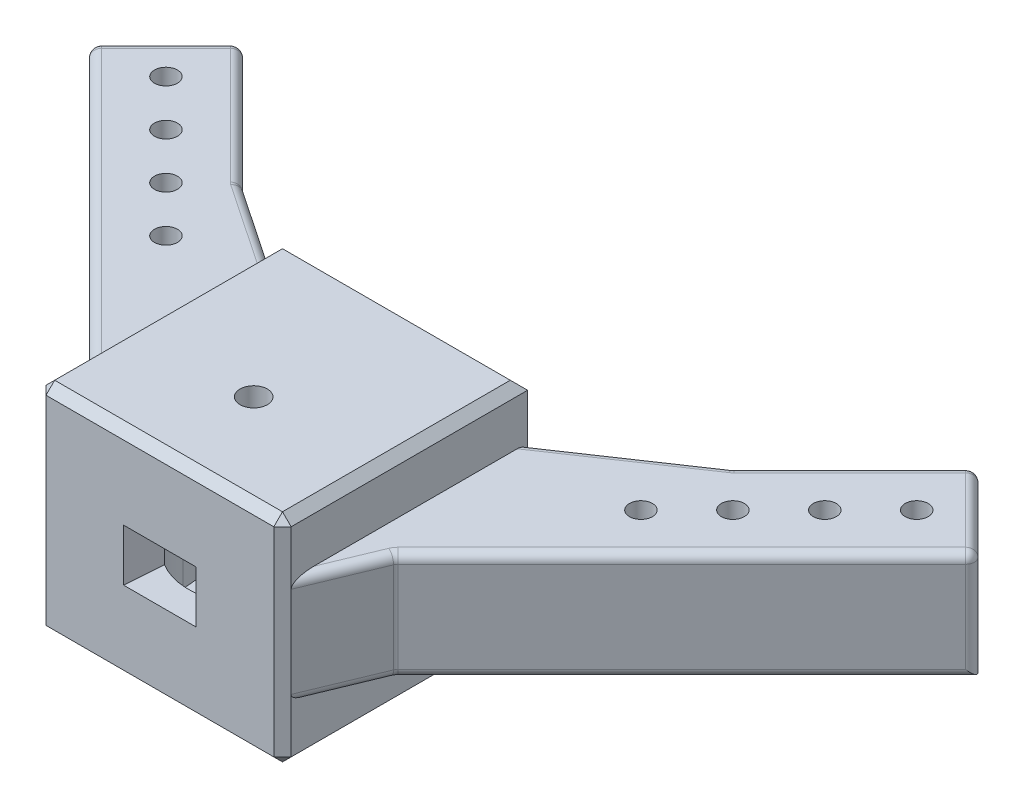
from build123d import *

# Parameters (mm, degrees)
SKETCH_1_W                      = 56.568542494
SKETCH_1_H                      = 56.568542494
SKETCH_1_R                      = 3.15
EXTRUDE_1_DEPTH                 = 25
SKETCH_1_3_R                    = 15
SKETCH_1_3_R_2                  = 3.15
CUT_EXTRUDE_1_DEPTH             = 20.15
EXTRUDE_2_DEPTH                 = 12.5
HOLE_WIZARD_15_25_15_25_1_D     = 15.3
HOLE_WIZARD_15_25_15_25_1_DEPTH = 75
SKETCH_8_R                      = 2.65
CUT_EXTRUDE_2_DEPTH             = 25
CUT_EXTRUDE_3_DEPTH             = 6
FILLET_3_R                      = 2
FILLET_4_R                      = 2
FILLET_5_R                      = 2
CHAMFER_3_SIZE                  = 1
CHAMFER_4_SIZE                  = 2


# Some blends are built 0.0001 mm under size
with BuildPart() as part:
    # 草图1 → 凸台-拉伸1 (new, symmetric)
    with BuildSketch(Plane(origin=(0, 0, 0), x_dir=(1, 0, 0), z_dir=(0, 1, 0))):
        Rectangle(SKETCH_1_W, SKETCH_1_H)
        with Locations(Location((0, -6.646698667, 0), (0, 0, 270))):
            Circle(SKETCH_1_R, mode=Mode.SUBTRACT)
    extrude(amount=EXTRUDE_1_DEPTH, both=True)

    # 草图1<3> → 切除-拉伸1 (cut, symmetric)
    # profile 1 of 2: a face of its own
    with BuildSketch(Plane(origin=(0, 0, 0), x_dir=(1, 0, 0), z_dir=(0, 1, 0))):
        with BuildLine():
            ThreePointArc((15, -6.646698667), (14.984153326, -7.336009274), (14.936646785, -8.023863443))
            Line((14.936646785, -8.023863443), (18.284271247, 28.284271247))
            Line((18.284271247, 28.284271247), (-18.284271247, 28.284271247))
            Line((-18.284271247, 28.284271247), (-14.936646785, -8.023863443))
            ThreePointArc((-14.936646785, -8.023863443), (-0.689310607, 8.337454659), (15, -6.646698667))
        make_face()
    # profile 2 of 2: a face of its own
    with BuildSketch(Plane(origin=(0, 0, 0), x_dir=(1, 0, 0), z_dir=(0, 1, 0))):
        with Locations((0, -6.646698667)):
            Circle(SKETCH_1_3_R)
        with Locations(Location((0, -6.646698667, 0), (0, 0, 270))):
            Circle(SKETCH_1_3_R_2, mode=Mode.SUBTRACT)
    extrude(amount=CUT_EXTRUDE_1_DEPTH, both=True, mode=Mode.SUBTRACT)

    # 草图3 → 凸台-拉伸2 (add, symmetric)
    with BuildSketch(Plane(origin=(0, 0, 0), x_dir=(1, 0, 0), z_dir=(0, 1, 0))):
        Polygon((28.284271247, 28.284271247), (28.284271247, -26.284271247), (35.355339059, -9.213203436), (102.530483272, 57.961940777), (84.852813742, 75.639610307), (56.568542495, 47.355339059), align=None)
    extrude_2 = extrude(amount=EXTRUDE_2_DEPTH, both=True)

    # Ø15.25 (15.25) 直径孔1
    with Locations(Plane(origin=(80.246212025, 0, -80.246212025), x_dir=(-0.707106781186546, 0, -0.707106781186549), z_dir=(0.707106781186549, 0, -0.707106781186546))):
        with Locations((-19.014718626, 0)):
            hole_wizard_15_25_15_25_1 = Hole(HOLE_WIZARD_15_25_15_25_1_D / 2, depth=HOLE_WIZARD_15_25_15_25_1_DEPTH)

    # 草图8 → 切除-拉伸2 (cut)
    with BuildSketch(Plane(origin=(17.146894682, 12.5, 17.146894682), x_dir=(0.7071067811865485, 0, -0.7071067811865467), z_dir=(0, -1, 0))):
        with Locations(Location((103.485281374, -5.234652387, 0), (0, 0, 135))):
            Circle(SKETCH_8_R)
        with Locations(Location((88.485281374, -5.234652387, 0), (0, 0, 135))):
            Circle(SKETCH_8_R)
        with Locations(Location((73.485281374, -5.234652387, 0), (0, 0, 135))):
            Circle(SKETCH_8_R)
        with Locations(Location((58.485281374, -5.234652387, 0), (0, 0, 135))):
            Circle(SKETCH_8_R)
    cut_extrude_2 = extrude(amount=CUT_EXTRUDE_2_DEPTH, mode=Mode.SUBTRACT)

    # 草图1<4> → 切除-拉伸3 (cut, symmetric)
    with BuildSketch(Plane(origin=(0, 0, 0), x_dir=(1, 0, 0), z_dir=(0, 1, 0))):
        with BuildLine():
            Line((8.364990441, -28.284271247), (7.75, -19.489498206))
            ThreePointArc((7.75, -19.489498206), (0, -21.646698667), (-7.75, -19.489498206))
            Line((-7.75, -19.489498206), (-8.364990441, -28.284271247))
            Line((-8.364990441, -28.284271247), (8.364990441, -28.284271247))
        make_face()
    extrude(amount=CUT_EXTRUDE_3_DEPTH, both=True, mode=Mode.SUBTRACT)

    # 镜向3: 凸台-拉伸2, Ø15.25 (15.25) 直径孔1, 切除-拉伸2 across plane
    add(extrude_2.mirror(Plane(origin=(0, 0, 0), x_dir=(0, 0, 1), z_dir=(1, 0, 0))))
    add(hole_wizard_15_25_15_25_1.mirror(Plane(origin=(0, 0, 0), x_dir=(0, 0, 1), z_dir=(1, 0, 0))), mode=Mode.SUBTRACT)
    add(cut_extrude_2.mirror(Plane(origin=(0, 0, 0), x_dir=(0, 0, 1), z_dir=(1, 0, 0))), mode=Mode.SUBTRACT)

    # 圆角3
    fillet_3_edges = [part.edges().sort_by_distance(p)[0] for p in [
        (31.819805153, -12.5, 17.748737342),
        (68.942911166, 12.5, -24.374368671),
        (35.355339059, 0, 9.213203436),
        (102.530483272, 0, -57.961940777),
        (70.710678119, 12.5, -61.497474683),
        (84.852813742, 0, -75.639610307),
        (42.426406871, 12.5, -37.819805153),
        (56.568542495, 0, -47.355339059),
        (31.819805153, 12.5, 17.748737342),
        (42.426406871, -12.5, -37.819805153),
        (70.710678119, -12.5, -61.497474683),
        (68.942911166, -12.5, -24.374368671),
    ]]
    fillet(fillet_3_edges, radius=FILLET_3_R)

    # 圆角4
    # the kernel refuses this fillet: 2 mm, written as the material it takes off along each edge
    with BuildSketch(Plane(origin=(84.852813742, 10.5, -72.811183182), x_dir=(0, 1, 0), z_dir=(0.7071067811865525, 0, -0.7071067811865428))) as fillet_4_piece_1_section:
        Polygon((0, 0), (FILLET_4_R, 0), (FILLET_4_R, -FILLET_4_R), (0, -FILLET_4_R), align=None)
    fillet_4_piece_1 = extrude(amount=FILLET_4_R, mode=Mode.PRIVATE)
    fillet_4_piece_1 = fillet_4_piece_1 - Plane(origin=(84.852813742, 10.5, -72.811183182), x_dir=(0.4999999999999968, -0.7071067811865476, 0.5000000000000033), z_dir=(0.7071067811865525, 0, -0.7071067811865428)) * Sphere(FILLET_4_R, mode=Mode.PRIVATE)
    add(fillet_4_piece_1, mode=Mode.SUBTRACT)
    with BuildSketch(Plane(origin=(99.702056147, 10.5, -57.961940777), x_dir=(0, 1, 0), z_dir=(0.7071067811865525, 0, -0.7071067811865428))) as fillet_4_piece_2_section:
        Polygon((0, 0), (FILLET_4_R, 0), (FILLET_4_R, FILLET_4_R), (0, FILLET_4_R), align=None)
    fillet_4_piece_2 = extrude(amount=FILLET_4_R, mode=Mode.PRIVATE)
    fillet_4_piece_2 = fillet_4_piece_2 - Plane(origin=(99.702056147, 10.5, -57.961940777), x_dir=(-0.4999999999999949, -0.7071067811865475, -0.5000000000000051), z_dir=(0.7071067811865525, 0, -0.7071067811865428)) * Sphere(FILLET_4_R, mode=Mode.PRIVATE)
    add(fillet_4_piece_2, mode=Mode.SUBTRACT)
    with BuildSketch(Plane(origin=(101.11626971, 12.5, -59.376154339), x_dir=(0, -1, 0), z_dir=(-0.7071067811865427, 0, -0.7071067811865523))) as fillet_4_piece_3:
        with BuildLine():
            CenterArc((FILLET_4_R, FILLET_4_R), FILLET_4_R, 180, 90)
            Line((0, FILLET_4_R), (0, 0))
            Line((0, 0), (FILLET_4_R, 0))
        make_face()
    extrude(amount=21, mode=Mode.SUBTRACT)

    # 圆角5
    fillet_5_edges = [part.edges().sort_by_distance(p)[0] for p in [
        (-42.426406871, -12.5, -37.819805153),
        (-70.710678119, -12.5, -61.497474683),
        (-56.568542495, 0, -47.355339059),
        (-93.691648507, -12.5, -66.800775542),
        (-84.852813742, 0, -75.639610307),
        (-68.942911166, -12.5, -24.374368671),
        (-102.530483272, 0, -57.961940777),
        (-31.819805153, 12.5, 17.748737342),
        (-35.355339059, 0, 9.213203436),
        (-42.426406871, 12.5, -37.819805153),
        (-70.710678119, 12.5, -61.497474683),
        (-93.691648507, 12.5, -66.800775542),
        (-68.942911166, 12.5, -24.374368671),
        (-31.819805153, -12.5, 17.748737342),
    ]]
    fillet(fillet_5_edges, radius=FILLET_5_R)

    # 倒角3
    chamfer_3_edges = [part.edges().sort_by_distance(p)[0] for p in [
        (-88.282281631, 0, -72.210142418),
        (88.282281631, 0, -72.210142418),
    ]]
    chamfer(chamfer_3_edges, length=CHAMFER_3_SIZE)

    # 倒角4
    chamfer_4_edges = [part.edges().sort_by_distance(p)[0] for p in [
        (0, 25, 28.284271247),
        (28.284271247, 0, 28.284271247),
        (-28.284271247, 0, 28.284271247),
        (28.284271247, 25, 0),
        (0, 25, -28.284271247),
        (-28.284271247, 25, 0),
        (0, -25, -28.284271247),
        (28.284271247, -25, 0),
        (0, -25, 28.284271247),
        (-28.284271247, -25, 0),
    ]]
    chamfer(chamfer_4_edges, length=CHAMFER_4_SIZE - 0.0001)  # a hair under: the kernel refuses the full size


solid = part.part
